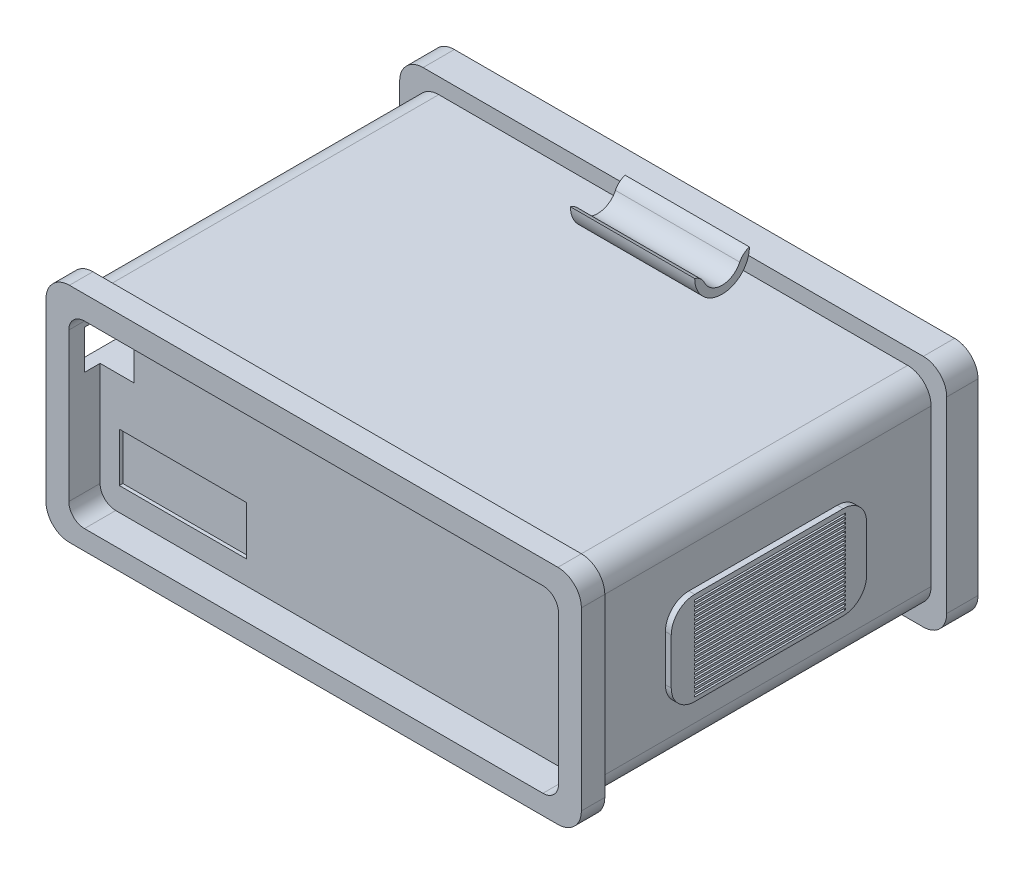
from build123d import *

# Parameters (mm, degrees)
SKETCH1_W           = 700
SKETCH1_H           = 300
BOSS_EXTRUDE1_DEPTH = 500
SKETCH3_W           = 700
SKETCH3_H           = 430
CUT_EXTRUDE1_DEPTH  = 20
SKETCH4_W           = 430
SKETCH4_H           = 280
CUT_EXTRUDE2_DEPTH  = 20
SKETCH5_W           = 680
SKETCH5_H           = 430
CUT_EXTRUDE3_DEPTH  = 20
SKETCH6_W           = 430
SKETCH6_H           = 260
CUT_EXTRUDE4_DEPTH  = 20
SKETCH7_W           = 30
SKETCH7_H           = 300
CUT_EXTRUDE5_DEPTH  = 7.5
SKETCH8_W           = 692.5
SKETCH8_H           = 30
CUT_EXTRUDE6_DEPTH  = 7.5
SKETCH9_W           = 30
SKETCH9_H           = 292.5
CUT_EXTRUDE7_DEPTH  = 7.5
SKETCH10_W          = 685
SKETCH10_H          = 30
CUT_EXTRUDE8_DEPTH  = 7.5
FILLET1_R           = 30
SKETCH11_W          = 250
SKETCH11_H          = 118.86902976
BOSS_EXTRUDE2_DEPTH = 7.5
FILLET2_R           = 30
SKETCH12_W          = 192.96167712
SKETCH12_H          = 2.5
CUT_EXTRUDE9_DEPTH  = 15.5
CUT_EXTRUDE10_DEPTH = 15
SKETCH14_W          = 626.594992833
SKETCH14_H          = 230
CUT_EXTRUDE11_DEPTH = 40
FILLET3_R           = 20
SKETCH15_W          = 162.5
SKETCH15_H          = 62.5
CUT_EXTRUDE12_DEPTH = 4.5
BOSS_EXTRUDE3_DEPTH = 452.5
SKETCH17_R          = 35
CUT_EXTRUDE13_DEPTH = 293.5
FILLET4_R           = 20
SKETCH18_W          = 80
SKETCH18_H          = 50
CUT_EXTRUDE14_DEPTH = 480


with BuildPart() as part:
    # Sketch1 → Boss-Extrude1 (new body)
    with BuildSketch(Plane.XY):
        with Locations((-3.535353535, -106.060606061)):
            Rectangle(SKETCH1_W, SKETCH1_H)
    extrude(amount=BOSS_EXTRUDE1_DEPTH)

    # Sketch3 → Cut-Extrude1 (cut)
    with BuildSketch(Plane(origin=(0, 43.939393939, 0), x_dir=(1, 0, 0), z_dir=(0, 1, 0))):
        with Locations((-3.535353535, -255)):
            Rectangle(SKETCH3_W, SKETCH3_H)
    extrude(amount=-CUT_EXTRUDE1_DEPTH, mode=Mode.SUBTRACT)

    # Sketch4 → Cut-Extrude2 (cut)
    with BuildSketch(Plane.ZY.offset(353.535353535)):
        with Locations((255, -116.060606061)):
            Rectangle(SKETCH4_W, SKETCH4_H)
    extrude(amount=-CUT_EXTRUDE2_DEPTH, mode=Mode.SUBTRACT)

    # Sketch5 → Cut-Extrude3 (cut)
    with BuildSketch(Plane(origin=(0, -256.060606061, 0), x_dir=(-1, 0, 0), z_dir=(0, -1, 0))):
        with Locations((-6.464646465, -255)):
            Rectangle(SKETCH5_W, SKETCH5_H)
    extrude(amount=-CUT_EXTRUDE3_DEPTH, mode=Mode.SUBTRACT)

    # Sketch6 → Cut-Extrude4 (cut)
    with BuildSketch(Plane(origin=(346.464646465, 0, 0), x_dir=(0, 0, -1), z_dir=(1, 0, 0))):
        with Locations((-255, -106.060606061)):
            Rectangle(SKETCH6_W, SKETCH6_H)
    extrude(amount=-CUT_EXTRUDE4_DEPTH, mode=Mode.SUBTRACT)

    # Sketch7 → Cut-Extrude5 (cut)
    with BuildSketch(Plane(origin=(346.464646465, 0, 0), x_dir=(0, 0, -1), z_dir=(1, 0, 0))):
        with Locations((-485, -106.060606061)):
            Rectangle(SKETCH7_W, SKETCH7_H)
    extrude(amount=-CUT_EXTRUDE5_DEPTH, mode=Mode.SUBTRACT)

    # Sketch8 → Cut-Extrude6 (cut)
    with BuildSketch(Plane(origin=(0, 43.939393939, 0), x_dir=(1, 0, 0), z_dir=(0, 1, 0))):
        with Locations((-7.285353535, -485)):
            Rectangle(SKETCH8_W, SKETCH8_H)
    extrude(amount=-CUT_EXTRUDE6_DEPTH, mode=Mode.SUBTRACT)

    # Sketch9 → Cut-Extrude7 (cut)
    with BuildSketch(Plane.ZY.offset(353.535353535)):
        with Locations((485, -109.810606061)):
            Rectangle(SKETCH9_W, SKETCH9_H)
    extrude(amount=-CUT_EXTRUDE7_DEPTH, mode=Mode.SUBTRACT)

    # Sketch10 → Cut-Extrude8 (cut)
    with BuildSketch(Plane(origin=(0, -256.060606061, 0), x_dir=(-1, 0, 0), z_dir=(0, -1, 0))):
        with Locations((3.535353535, -485)):
            Rectangle(SKETCH10_W, SKETCH10_H)
    extrude(amount=-CUT_EXTRUDE8_DEPTH, mode=Mode.SUBTRACT)

    # Fillet1
    fillet1_edges = [part.edges().sort_by_distance(p)[0] for p in [
        (338.964646465, 36.439393939, 485),
        (-346.035353535, 36.439393939, 485),
        (-346.035353535, -248.560606061, 485),
        (338.964646465, -248.560606061, 485),
        (-353.535353535, 43.939393939, 20),
        (346.464646465, 43.939393939, 20),
        (-353.535353535, -256.060606061, 20),
        (-333.535353535, 23.939393939, 255),
        (346.464646465, -256.060606061, 20),
        (-333.535353535, -236.060606061, 255),
        (326.464646465, 23.939393939, 255),
        (326.464646465, -236.060606061, 255),
    ]]
    fillet(fillet1_edges, radius=FILLET1_R)

    # Sketch11 → Boss-Extrude2 (add)
    with BuildSketch(Plane(origin=(326.464646465, 0, 0), x_dir=(0, 0, -1), z_dir=(1, 0, 0))):
        with Locations((-255, -115.495120941)):
            Rectangle(SKETCH11_W, SKETCH11_H)
    extrude(amount=BOSS_EXTRUDE2_DEPTH)

    # Fillet2
    fillet2_edges = [part.edges().sort_by_distance(p)[0] for p in [
        (330.214646465, -56.060606061, 130),
        (330.214646465, -56.060606061, 380),
        (330.214646465, -174.929635821, 380),
        (330.214646465, -174.929635821, 130),
    ]]
    fillet(fillet2_edges, radius=FILLET2_R)

    # Sketch12 → Cut-Extrude9 (cut)
    with BuildSketch(Plane(origin=(333.964646465, 0, 0), x_dir=(0, 0, -1), z_dir=(1, 0, 0))):
        with Locations((-253.51916144, -63.597402625)):
            Rectangle(SKETCH12_W, SKETCH12_H)
        with Locations((-253.51916144, -68.597402625)):
            Rectangle(SKETCH12_W, SKETCH12_H)
        with Locations((-253.51916144, -73.597402625)):
            Rectangle(SKETCH12_W, SKETCH12_H)
        with Locations((-253.51916144, -78.597402625)):
            Rectangle(SKETCH12_W, SKETCH12_H)
        with Locations((-253.51916144, -83.597402625)):
            Rectangle(SKETCH12_W, SKETCH12_H)
        with Locations((-253.51916144, -88.597402625)):
            Rectangle(SKETCH12_W, SKETCH12_H)
        with Locations((-253.51916144, -93.597402625)):
            Rectangle(SKETCH12_W, SKETCH12_H)
        with Locations((-253.51916144, -98.597402625)):
            Rectangle(SKETCH12_W, SKETCH12_H)
        with Locations((-253.51916144, -103.597402625)):
            Rectangle(SKETCH12_W, SKETCH12_H)
        with Locations((-253.51916144, -108.597402625)):
            Rectangle(SKETCH12_W, SKETCH12_H)
        with Locations((-253.51916144, -113.597402625)):
            Rectangle(SKETCH12_W, SKETCH12_H)
        with Locations((-253.51916144, -118.597402625)):
            Rectangle(SKETCH12_W, SKETCH12_H)
        with Locations((-253.51916144, -123.597402625)):
            Rectangle(SKETCH12_W, SKETCH12_H)
        with Locations((-253.51916144, -128.597402625)):
            Rectangle(SKETCH12_W, SKETCH12_H)
        with Locations((-253.51916144, -133.597402625)):
            Rectangle(SKETCH12_W, SKETCH12_H)
        with Locations((-253.51916144, -138.597402625)):
            Rectangle(SKETCH12_W, SKETCH12_H)
        with Locations((-253.51916144, -143.597402625)):
            Rectangle(SKETCH12_W, SKETCH12_H)
        with Locations((-253.51916144, -148.597402625)):
            Rectangle(SKETCH12_W, SKETCH12_H)
        with Locations((-253.51916144, -153.597402625)):
            Rectangle(SKETCH12_W, SKETCH12_H)
        with Locations((-253.51916144, -158.597402625)):
            Rectangle(SKETCH12_W, SKETCH12_H)
        with Locations((-253.51916144, -163.597402625)):
            Rectangle(SKETCH12_W, SKETCH12_H)
        with Locations((-253.51916144, -168.597402625)):
            Rectangle(SKETCH12_W, SKETCH12_H)
    extrude(amount=-CUT_EXTRUDE9_DEPTH, mode=Mode.SUBTRACT)

    # Sketch13 → Cut-Extrude10 (cut)
    with BuildSketch(Plane(origin=(0, 0, 0), x_dir=(-1, 0, 0), z_dir=(0, 0, -1))):
        with BuildLine():
            Line((-307.251280684, -30.943983287), (-47.251280684, -30.943983287))
            ThreePointArc((-47.251280684, -30.943983287), (-37.251280684, -40.943983287), (-47.251280684, -50.943983287))
            Line((-47.251280684, -50.943983287), (-307.251280684, -50.943983287))
            ThreePointArc((-307.251280684, -50.943983287), (-317.251280684, -40.943983287), (-307.251280684, -30.943983287))
        make_face()
    extrude(amount=-CUT_EXTRUDE10_DEPTH, mode=Mode.SUBTRACT)

    # Sketch14 → Cut-Extrude11 (cut)
    with BuildSketch(Plane.XY.offset(500)):
        with Locations((-3.535353535, -108.560606061)):
            Rectangle(SKETCH14_W, SKETCH14_H)
    extrude(amount=-CUT_EXTRUDE11_DEPTH, mode=Mode.SUBTRACT)

    # Fillet3
    fillet3_edges = [part.edges().sort_by_distance(p)[0] for p in [
        (-316.832849952, -223.560606061, 480),
        (-316.832849952, 6.439393939, 480),
        (309.762142881, 6.439393939, 480),
        (309.762142881, -223.560606061, 480),
    ]]
    fillet(fillet3_edges, radius=FILLET3_R)

    # Sketch15 → Cut-Extrude12 (cut)
    with BuildSketch(Plane.XY.offset(460)):
        with Locations((-211.025338645, -162.310606061)):
            Rectangle(SKETCH15_W, SKETCH15_H)
    extrude(amount=-CUT_EXTRUDE12_DEPTH, mode=Mode.SUBTRACT)

    # Sketch18 → Cut-Extrude14 (cut)
    with BuildSketch(Plane(origin=(0, 0, 0), x_dir=(-1, 0, 0), z_dir=(0, 0, -1))):
        with Locations((313.535353535, -45.468908002)):
            Rectangle(SKETCH18_W, SKETCH18_H)
    extrude(amount=-CUT_EXTRUDE14_DEPTH, mode=Mode.SUBTRACT)


with BuildPart() as body_2:
    # Sketch16 → Boss-Extrude3 (new body)
    with BuildSketch(Plane.ZY.offset(353.535353535)):
        with BuildLine():
            Line((45, 58.939393939), (55, 58.939393939))
            ThreePointArc((55, 58.939393939), (80, 33.939393939), (105, 58.939393939))
            Line((105, 58.939393939), (115, 58.939393939))
            ThreePointArc((115, 58.939393939), (80, 23.939393939), (45, 58.939393939))
        make_face()
    extrude(amount=-BOSS_EXTRUDE3_DEPTH)

    # Sketch17 → Cut-Extrude13 (cut)
    with BuildSketch(Plane.ZY.offset(353.535353535)):
        with Locations((80, 58.939393939)):
            Circle(SKETCH17_R)
    extrude(amount=-CUT_EXTRUDE13_DEPTH, mode=Mode.SUBTRACT)

    # Fillet4
    # the kernel refuses this fillet: 20 mm, written as the material it takes off along each edge
    with BuildSketch(Plane(origin=(-87.312589815, 58.939393939, 55), x_dir=(0, 0, -1), z_dir=(1, 0, 0))) as fillet4_piece_1:
        with BuildLine():
            CenterArc((15.714285714, -19.16629695), FILLET4_R, 106.601549599, 48.189685104)
            Line((-2.380952381, -10.64794275), (-2.742857143, -10.477575666))
            ThreePointArc((-2.742857143, -10.477575666), (-0.992858205, -5.3681601), (-0.4, 0))
            Line((-0.4, 0), (0, 0.4))
            ThreePointArc((0, 0.4), (5, 0.4), (9.885714286, 0.383325939))
            Line((9.885714286, 0.383325939), (10, 0))
        make_face()
    extrude(amount=213.554472559, mode=Mode.SUBTRACT)
    with BuildSketch(Plane(origin=(-87.312589815, 58.939393939, 105), x_dir=(0, -0.9759000729485332, -0.2182178902359923), z_dir=(1, 0, 0))) as fillet4_piece_2:
        with BuildLine():
            CenterArc((15.275252317, -19.518001459), FILLET4_R, 102.604382648, 48.189685104)
            Line((-2.182178902, -9.759000729), (-2.531327527, -9.563820715))
            ThreePointArc((-2.531327527, -9.563820715), (-1.48144948, -4.792213209), (-0.390360029, 0.087287156))
            Line((-0.390360029, 0.087287156), (0.087287156, 0.390360029))
            ThreePointArc((0.087287156, 0.390360029), (5.455447256, -0.202498176), (10.823607356, 0.390360029))
            Line((10.823607356, 0.390360029), (10.910894512, 0))
        make_face()
    extrude(amount=213.554472559, mode=Mode.SUBTRACT)


solid = Compound([part.part, body_2.part])
